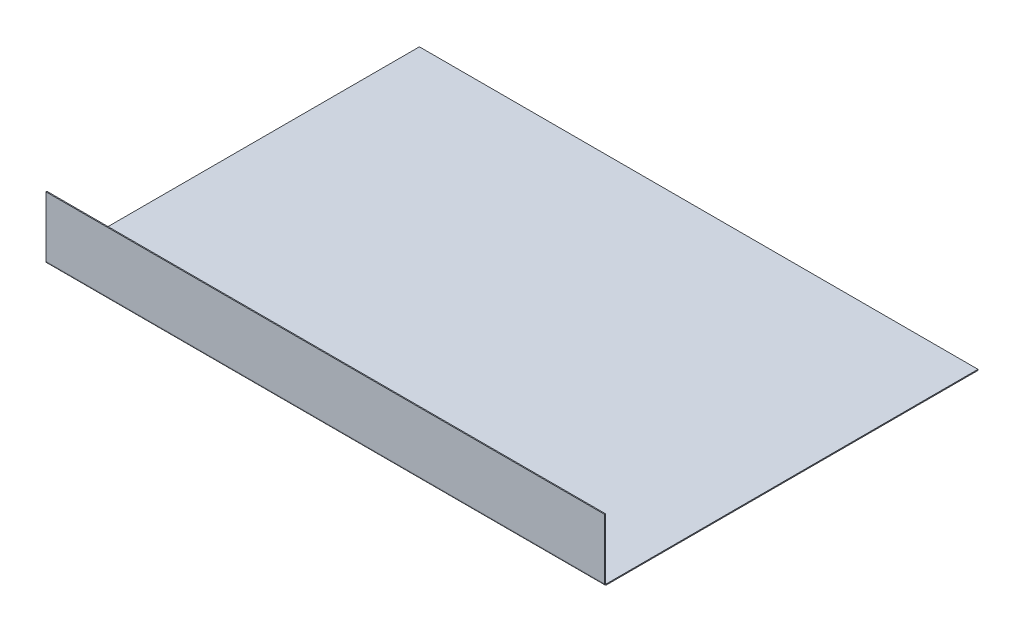
from build123d import *

# Parameters (mm, degrees)
SKETCH1_W                    = 457.2
SKETCH1_H                    = 304.8
BASE_FLANGE1_DEPTH           = 0.8128
EDGE_FLANGE1_STRIP_W         = 4.7244
EDGE_FLANGE1_STRIP_H         = 0.8128
EDGE_FLANGE1_STRIP_CUT_DEPTH = 457.2
EDGE_FLANGE1_DEPTH           = 457.2


# Sheet-metal steps are written as plain solids
with BuildPart() as part:
    # Sketch1 → Base-Flange1 (new body)
    with BuildSketch(Plane(origin=(0, 0, 0), x_dir=(1, 0, 0), z_dir=(0, 1, 0))):
        with Locations((0, -152.4)):
            Rectangle(SKETCH1_W, SKETCH1_H)
    extrude(amount=-BASE_FLANGE1_DEPTH)

    # Edge-Flange1 strip (across the edge) → Edge-Flange1 strip cut (cut)
    with BuildSketch(Plane(origin=(-228.6, 0, 304.8), x_dir=(0, 0, -1), z_dir=(1, 0, 0))):
        with Locations((-1.6256, -0.4064)):
            Rectangle(EDGE_FLANGE1_STRIP_W, EDGE_FLANGE1_STRIP_H)
    extrude(amount=EDGE_FLANGE1_STRIP_CUT_DEPTH, mode=Mode.SUBTRACT)

    # Edge-Flange1 section (across the edge) → Edge-Flange1 (add)
    with BuildSketch(Plane(origin=(-228.6, 0, 304.8), x_dir=(0, 0, -1), z_dir=(1, 0, 0))):
        with BuildLine():
            Line((-0.8128, 0.7366), (-0.8128, 49.9872))
            Line((-0.8128, 49.9872), (0, 49.9872))
            Line((0, 49.9872), (0, 0.7366))
            ThreePointArc((0, 0.7366), (0.215745145, 0.215745145), (0.7366, 0))
            Line((0.7366, 0), (0.7366, -0.8128))
            ThreePointArc((0.7366, -0.8128), (-0.358991247, -0.358991247), (-0.8128, 0.7366))
        make_face()
    extrude(amount=EDGE_FLANGE1_DEPTH)


solid = part.part
